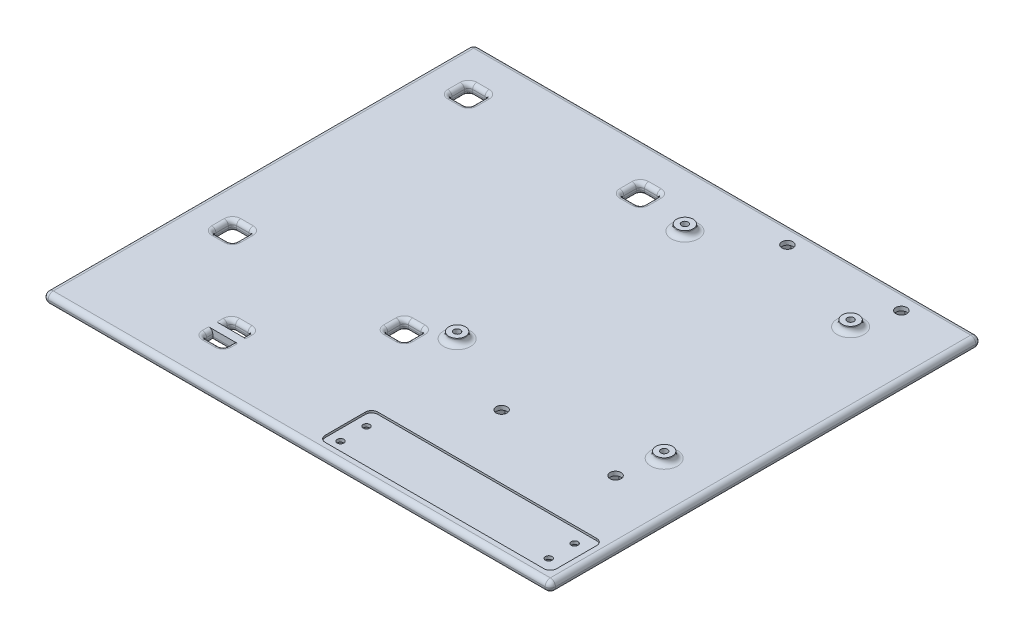
from build123d import *

# Parameters (mm, degrees)
ESQUISSE1_W             = 120
ESQUISSE1_H             = 120
BOSS_EXTRU_1_DEPTH      = 5
ESQUISSE2_R             = 4
BOSS_EXTRU_2_DEPTH      = 3
ESQUISSE7_W             = 245
ESQUISSE7_H             = 208
BOSS_EXTRU_3_DEPTH      = 5
D_GAGEMENT_M31_D        = 3.2
ENL_V_MAT_EXTRU_1_DEPTH = 3
ESQUISSE9_W             = 111.696072678
ESQUISSE9_H             = 25.4
ENL_V_MAT_EXTRU_2_DEPTH = 1
D_GAGEMENT_M32_D        = 3.2
ENL_V_MAT_EXTRU_3_DEPTH = 2.5
D_GAGEMENT_M51_D        = 5.3
ESQUISSE17_W            = 10
ESQUISSE17_H            = 10
ENL_V_MAT_EXTRU_4_DEPTH = 5
ENL_V_MAT_EXTRU_5_DEPTH = 3
ESQUISSE20_W            = 10
ESQUISSE20_H            = 5
ENL_V_MAT_EXTRU_6_DEPTH = 5
CONG_1_R                = 2
CONG_2_R                = 2.5
CONG_3_R                = 2.5
CONG_4_R                = 3


with BuildPart() as part:
    # Esquisse1 → Boss.-Extru.1 (new body)
    with BuildSketch(Plane(origin=(0, 0, 0), x_dir=(1, 0, 0), z_dir=(0, 1, 0))):
        Rectangle(ESQUISSE1_W, ESQUISSE1_H)
    extrude(amount=BOSS_EXTRU_1_DEPTH)

    # Esquisse2 → Boss.-Extru.2 (add)
    with BuildSketch(Plane(origin=(0, 5, 0), x_dir=(1, 0, 0), z_dir=(0, 1, 0))):
        with Locations(Location((-40, 50, 0), (0, 0, 270))):
            Circle(ESQUISSE2_R)
        with Locations(Location((40, 50, 0), (0, 0, 270))):
            Circle(ESQUISSE2_R)
        with Locations(Location((50, -50, 0), (0, 0, 270))):
            Circle(ESQUISSE2_R)
        with Locations(Location((-50, -50, 0), (0, 0, 270))):
            Circle(ESQUISSE2_R)
    extrude(amount=BOSS_EXTRU_2_DEPTH)

    # Esquisse7 → Boss.-Extru.3 (add)
    with BuildSketch(Plane(origin=(0, 0, 0), x_dir=(1, 0, 0), z_dir=(0, 1, 0))):
        with Locations((-47.5, -26)):
            Rectangle(ESQUISSE7_W, ESQUISSE7_H)
    extrude(amount=BOSS_EXTRU_3_DEPTH)

    # Dégagement M31 (through all)
    with Locations(Plane(origin=(0, 8, 0), x_dir=(1, 0, 0), z_dir=(0, 1, 0))):
        with Locations((-40, 50), (40, 50), (50, -50), (-50, -50)):
            Hole(D_GAGEMENT_M31_D / 2)

    # Esquisse5 → Enlèv. mat.-Extru.1 (cut)
    with BuildSketch(Plane.XZ):
        Polygon((-46.766838493, 50), (-48.383419246, 52.8), (-51.616580754, 52.8), (-53.233161507, 50), (-51.616580754, 47.2), (-48.383419246, 47.2), align=None)
        Polygon((53.233161507, 50), (51.616580754, 52.8), (48.383419246, 52.8), (46.766838493, 50), (48.383419246, 47.2), (51.616580754, 47.2), align=None)
        Polygon((-36.766838493, -50), (-38.383419246, -47.2), (-41.616580754, -47.2), (-43.233161507, -50), (-41.616580754, -52.8), (-38.383419246, -52.8), align=None)
        Polygon((43.233161507, -50), (41.616580754, -47.2), (38.383419246, -47.2), (36.766838493, -50), (38.383419246, -52.8), (41.616580754, -52.8), align=None)
    extrude(amount=-ENL_V_MAT_EXTRU_1_DEPTH, mode=Mode.SUBTRACT)

    # Esquisse9 → Enlèv. mat.-Extru.2 (cut)
    with BuildSketch(Plane(origin=(0, 5, 0), x_dir=(1, 0, 0), z_dir=(0, 1, 0))):
        with Locations((14.351963661, -112.5)):
            Rectangle(ESQUISSE9_W, ESQUISSE9_H)
    extrude(amount=-ENL_V_MAT_EXTRU_2_DEPTH, mode=Mode.SUBTRACT)

    # Dégagement M32 (through all)
    with Locations(Plane(origin=(0, 4, 0), x_dir=(1, 0, 0), z_dir=(0, 1, 0))):
        with Locations((63, -118.75), (63.009809785, -106.253146839), (-36.266148601, -107.5), (-36.296072678, -120)):
            Hole(D_GAGEMENT_M32_D / 2)

    # Esquisse13 → Enlèv. mat.-Extru.3 (cut)
    with BuildSketch(Plane(origin=(0, 0, 0), x_dir=(-1, 0, 0), z_dir=(0, -1, 0))):
        Polygon((-59.776648278, -106.253146839), (-61.393229031, -103.453146839), (-64.626390539, -103.453146839), (-66.242971293, -106.253146839), (-64.626390539, -109.053146839), (-61.393229031, -109.053146839), align=None)
        Polygon((-59.766838493, -118.75), (-61.383419246, -115.95), (-64.616580754, -115.95), (-66.233161507, -118.75), (-64.616580754, -121.55), (-61.383419246, -121.55), align=None)
        Polygon((37.912653432, -122.8), (39.529234186, -120), (37.912653432, -117.2), (34.679491924, -117.2), (33.062911171, -120), (34.679491924, -122.8), align=None)
        Polygon((37.882729354, -110.3), (39.499310108, -107.5), (37.882729354, -104.7), (34.649567847, -104.7), (33.032987093, -107.5), (34.649567847, -110.3), align=None)
    extrude(amount=-ENL_V_MAT_EXTRU_3_DEPTH, mode=Mode.SUBTRACT)

    # Dégagement M51 (through all)
    with Locations(Plane(origin=(0, 5, 0), x_dir=(1, 0, 0), z_dir=(0, 1, 0))):
        with Locations((-9.5, 69), (45.5, 69), (-9.5, -69), (45.5, -69)):
            Hole(D_GAGEMENT_M51_D / 2)

    # Esquisse17 → Enlèv. mat.-Extru.4 (cut)
    with BuildSketch(Plane(origin=(0, 5, 0), x_dir=(1, 0, 0), z_dir=(0, 1, 0))):
        with Locations((-149.5, 55)):
            Rectangle(ESQUISSE17_W, ESQUISSE17_H)
        with Locations((-149.5, -59)):
            Rectangle(ESQUISSE17_W, ESQUISSE17_H)
        with Locations((-66.5, -59)):
            Rectangle(ESQUISSE17_W, ESQUISSE17_H)
        with Locations((-66.5, 55)):
            Rectangle(ESQUISSE17_W, ESQUISSE17_H)
    extrude(amount=-ENL_V_MAT_EXTRU_4_DEPTH, mode=Mode.SUBTRACT)

    # Esquisse18 → Enlèv. mat.-Extru.5 (cut)
    with BuildSketch(Plane(origin=(0, 0, 0), x_dir=(-1, 0, 0), z_dir=(0, -1, 0))):
        Polygon((11.860087211, 73.037324405), (7.183618107, 73.062557683), (4.823530896, 69.025233278), (7.139912789, 64.962675595), (11.816381893, 64.937442317), (14.176469104, 68.974766722), align=None)
        Polygon((-43.139912789, 73.037324405), (-47.816381893, 73.062557683), (-50.176469104, 69.025233278), (-47.860087211, 64.962675595), (-43.183618107, 64.937442317), (-40.823530896, 68.974766722), align=None)
        Polygon((-40.82346282, -69), (-43.16173141, -64.95), (-47.83826859, -64.95), (-50.17653718, -69), (-47.83826859, -73.05), (-43.16173141, -73.05), align=None)
        Polygon((14.17653718, -69), (11.83826859, -64.95), (7.16173141, -64.95), (4.82346282, -69), (7.16173141, -73.05), (11.83826859, -73.05), align=None)
    extrude(amount=-ENL_V_MAT_EXTRU_5_DEPTH, mode=Mode.SUBTRACT)

    # Esquisse20 → Enlèv. mat.-Extru.6 (cut)
    with BuildSketch(Plane(origin=(0, 5, 0), x_dir=(1, 0, 0), z_dir=(0, 1, 0))):
        with Locations((-108, -107.5)):
            Rectangle(ESQUISSE20_W, ESQUISSE20_H)
        with Locations((-108, -98.5)):
            Rectangle(ESQUISSE20_W, ESQUISSE20_H)
    extrude(amount=-ENL_V_MAT_EXTRU_6_DEPTH, mode=Mode.SUBTRACT)

    # Congé1
    cong_1_edges = [part.edges().sort_by_distance(p)[0] for p in [
        (-61.5, 2.5, -60),
        (-61.5, 2.5, -50),
        (-71.5, 2.5, -50),
        (-71.5, 2.5, -60),
        (-61.5, 5, -55),
        (-66.5, 5, -60),
        (-71.5, 5, -55),
        (-66.5, 5, -50),
        (-61.5, 0, -55),
        (-66.5, 0, -50),
        (-71.5, 0, -55),
        (-66.5, 0, -60),
        (-61.5, 2.5, 54),
        (-61.5, 2.5, 64),
        (-71.5, 2.5, 64),
        (-71.5, 2.5, 54),
        (-61.5, 5, 59),
        (-66.5, 5, 54),
        (-71.5, 5, 59),
        (-66.5, 5, 64),
        (-61.5, 0, 59),
        (-66.5, 0, 64),
        (-71.5, 0, 59),
        (-66.5, 0, 54),
        (-144.5, 2.5, 54),
        (-144.5, 2.5, 64),
        (-154.5, 2.5, 64),
        (-154.5, 2.5, 54),
        (-144.5, 5, 59),
        (-149.5, 5, 54),
        (-154.5, 5, 59),
        (-149.5, 5, 64),
        (-144.5, 0, 59),
        (-149.5, 0, 64),
        (-154.5, 0, 59),
        (-149.5, 0, 54),
        (-144.5, 2.5, -60),
        (-144.5, 2.5, -50),
        (-154.5, 2.5, -50),
        (-154.5, 2.5, -60),
        (-144.5, 5, -55),
        (-149.5, 5, -60),
        (-154.5, 5, -55),
        (-149.5, 5, -50),
        (-144.5, 0, -55),
        (-149.5, 0, -50),
        (-154.5, 0, -55),
        (-149.5, 0, -60),
        (-103, 2.5, 110),
        (-113, 2.5, 110),
        (-103, 5, 107.5),
        (-113, 5, 107.5),
        (-108, 5, 110),
        (-103, 0, 107.5),
        (-108, 0, 110),
        (-113, 0, 107.5),
        (-108, 0, 105),
        (-103, 2.5, 96),
        (-113, 2.5, 96),
        (-103, 5, 98.5),
        (-108, 5, 96),
        (-113, 5, 98.5),
        (-103, 0, 98.5),
        (-108, 0, 101),
        (-113, 0, 98.5),
        (-108, 0, 96),
    ]]
    fillet(cong_1_edges, radius=CONG_1_R - 0.0001)  # a hair under: the kernel refuses the full size

    # Congé2
    cong_2_edges = [part.edges().sort_by_distance(p)[0] for p in [
        (-47.5, 0, -78),
        (75, 2.5, -78),
        (-170, 0, 26),
        (-170, 2.5, -78),
        (-47.5, 0, 130),
        (-170, 2.5, 130),
        (75, 0, 26),
        (75, 2.5, 130),
        (-47.5, 5, -78),
        (-170, 5, 26),
        (-47.5, 5, 130),
        (75, 5, 26),
    ]]
    fillet(cong_2_edges, radius=CONG_2_R - 0.0001)  # a hair under: the kernel refuses the full size

    # Congé3
    cong_3_edges = [part.edges().sort_by_distance(p)[0] for p in [
        (-40, 5, -54),
        (40, 5, -54),
        (50, 5, 46),
        (-50, 5, 46),
    ]]
    fillet(cong_3_edges, radius=CONG_3_R)

    # Congé4
    cong_4_edges = [part.edges().sort_by_distance(p)[0] for p in [
        (70.2, 4.5, 99.8),
        (70.2, 4.5, 125.2),
        (-41.496072678, 4.5, 125.2),
        (-41.496072678, 4.5, 99.8),
    ]]
    fillet(cong_4_edges, radius=CONG_4_R)


solid = part.part
